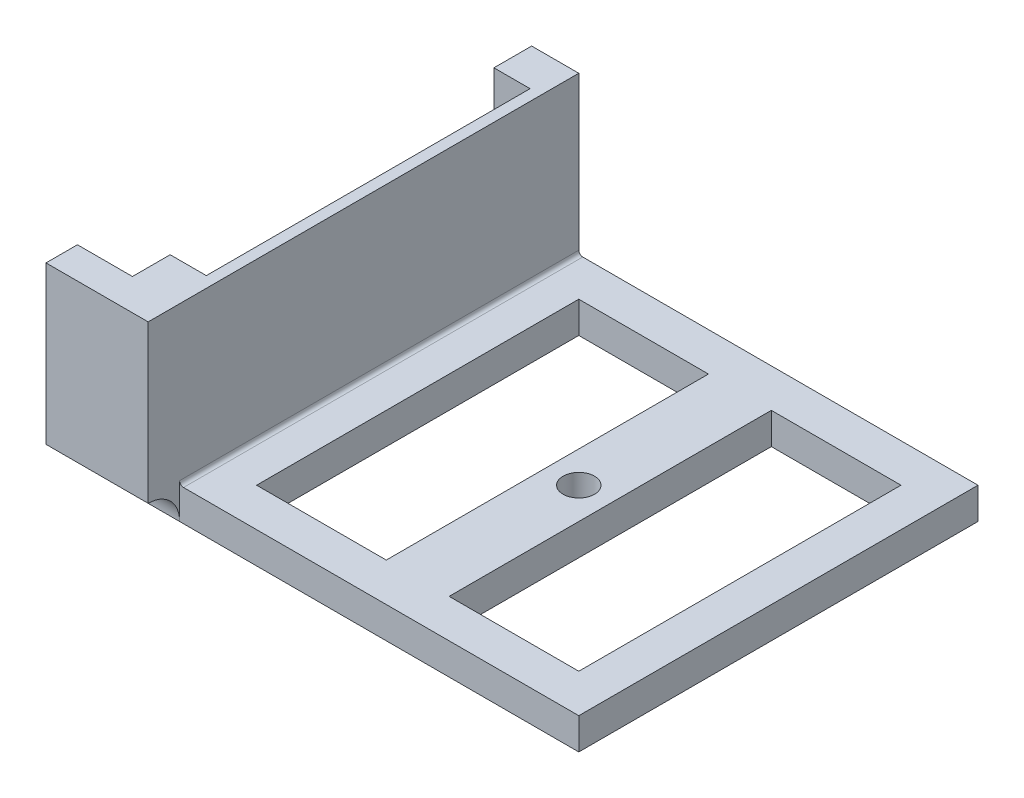
from build123d import *

# Parameters (mm, degrees)
SKETCH2_R               = 1
SKETCH2_W               = 8.25
SKETCH2_H               = 20.5
BOSS_EXTRUDE1_DEPTH     = 2
SKETCH3_W               = 3
SKETCH3_H               = 25.4
BOSS_EXTRUDE2_DEPTH     = 10
FILLET1_R               = 0.25
SKETCH5_W               = 6.5
SKETCH5_H               = 10
BOSS_EXTRUDE3_DEPTH     = 2
CUT_EXTRUDE1_DEPTH      = 27.994999537
CUT_EXTRUDE1_DEPTH_BACK = 27.994999537
SKETCH6_W               = 2.6
SKETCH6_H               = 20.6
FILLET3_R               = 2


with BuildPart() as part:
    # Sketch2 → Boss-Extrude1 (new body)
    with BuildSketch(Plane(origin=(0, 0, 0), x_dir=(1, 0, 0), z_dir=(0, 1, 0))):
        Polygon((-12.7, 12.7), (-15.7, 12.7), (-15.7, -12.7), (-12.7, -12.7), (12.7, -12.7), (12.7, 12.7), align=None)
        with Locations(Location((0, 0, 0), (0, 0, 270))):
            Circle(SKETCH2_R, mode=Mode.SUBTRACT)
        with Locations((6.125, 0)):
            Rectangle(SKETCH2_W, SKETCH2_H, mode=Mode.SUBTRACT)
        with Locations((-6.125, 0)):
            Rectangle(SKETCH2_W, SKETCH2_H, mode=Mode.SUBTRACT)
    extrude(amount=BOSS_EXTRUDE1_DEPTH)

    # Sketch3 → Boss-Extrude2 (add)
    with BuildSketch(Plane(origin=(0, 2, 0), x_dir=(1, 0, 0), z_dir=(0, 1, 0))):
        with Locations((-14.2, 0)):
            Rectangle(SKETCH3_W, SKETCH3_H)
    extrude(amount=BOSS_EXTRUDE2_DEPTH)

    # Fillet1
    fillet1_edges = [part.edges().sort_by_distance(p)[0] for p in [
        (-12.7, 2, 0),
    ]]
    fillet(fillet1_edges, radius=FILLET1_R)

    # Sketch5 → Boss-Extrude3 (add)
    with BuildSketch(Plane.XY.offset(12.7)):
        with Locations((-15.95, 7)):
            Rectangle(SKETCH5_W, SKETCH5_H)
    extrude(amount=BOSS_EXTRUDE3_DEPTH)

    # Sketch6 → Cut-Extrude1 (cut, two sides: drawn at the far end of the back side and taken through both)
    with BuildSketch(Plane.XZ.offset(-CUT_EXTRUDE1_DEPTH_BACK)):
        with Locations((-14.7, 0)):
            Rectangle(SKETCH6_W, SKETCH6_H)
    extrude(amount=CUT_EXTRUDE1_DEPTH + CUT_EXTRUDE1_DEPTH_BACK, mode=Mode.SUBTRACT)

    # Fillet3
    fillet3_edges = [part.edges().sort_by_distance(p)[0] for p in [
        (-14.2, 2, 12.7),
    ]]
    fillet(fillet3_edges, radius=FILLET3_R - 0.0001)  # a hair under: the kernel refuses the full size


solid = part.part
